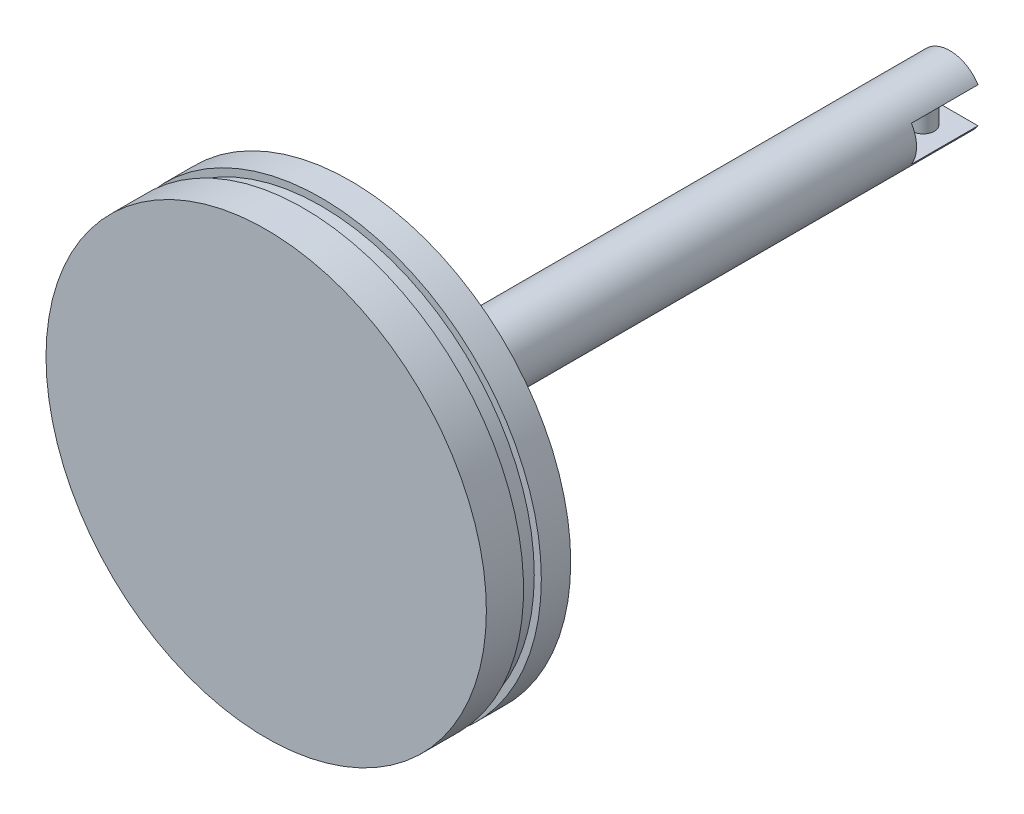
from build123d import *

# Parameters (mm, degrees)
SKETCH1_R           = 49.6
BOSS_EXTRUDE1_DEPTH = 3
SKETCH2_R           = 49.6
SKETCH2_R_2         = 46
BOSS_EXTRUDE2_DEPTH = 15
SKETCH3_R           = 49.6
BOSS_EXTRUDE3_DEPTH = 4
SKETCH4_R           = 2.5
SKETCH4_R_2         = 5
BOSS_EXTRUDE4_DEPTH = 16
SKETCH5_R           = 7.5
BOSS_EXTRUDE5_DEPTH = 135
SKETCH6_W           = 4
SKETCH6_H           = 2.877326051
SKETCH7_W           = 21.216623492
SKETCH7_H           = 8
CUT_EXTRUDE1_DEPTH  = 15
SKETCH8_R           = 2.5
BOSS_EXTRUDE6_DEPTH = 7


with BuildPart() as part:
    # Sketch1 → Boss-Extrude1 (new body)
    with BuildSketch(Plane.XY):
        Circle(SKETCH1_R)
    extrude(amount=BOSS_EXTRUDE1_DEPTH)

    # Sketch2 → Boss-Extrude2 (add)
    with BuildSketch(Plane.XY):
        Circle(SKETCH2_R)
        Circle(SKETCH2_R_2, mode=Mode.SUBTRACT)
    extrude(amount=BOSS_EXTRUDE2_DEPTH)

    # Sketch3 → Boss-Extrude3 (add)
    with BuildSketch(Plane.XY.offset(15)):
        Circle(SKETCH3_R)
    extrude(amount=BOSS_EXTRUDE3_DEPTH)

    # Sketch4 → Boss-Extrude4 (add)
    with BuildSketch(Plane.XY.offset(3)):
        with Locations((-35.987639667, -3.679667055)):
            Circle(SKETCH4_R)
        with Locations((-20.971152057, -26.371770497)):
            Circle(SKETCH4_R)
        with Locations((10.797391405, -30.746904789)):
            Circle(SKETCH4_R)
        with Locations((29.028310122, -5.229746582)):
            Circle(SKETCH4_R)
        with Locations((17.402549466, 21.919229393)):
            Circle(SKETCH4_R)
        with Locations((-12.555375397, 26.332978184)):
            Circle(SKETCH4_R)
        Circle(SKETCH4_R_2)
    extrude(amount=BOSS_EXTRUDE4_DEPTH)

    # Sketch5 → Boss-Extrude5 (add)
    with BuildSketch(Plane.XY):
        Circle(SKETCH5_R)
    extrude(amount=-BOSS_EXTRUDE5_DEPTH)

    # Sketch6 → Cut-Revolve1 (revolve, cut)
    with BuildSketch(Plane(origin=(0, 0, 0), x_dir=(0, 0, -1), z_dir=(1, 0, 0))):
        with Locations((-8.620257655, -49.449045314)):
            Rectangle(SKETCH6_W, SKETCH6_H)
    revolve(axis=Axis((0, 0, 0), (0, 0, 1)), mode=Mode.SUBTRACT)

    # Sketch7 → Cut-Extrude1 (cut)
    with BuildSketch(Plane(origin=(0, 0, -135), x_dir=(-1, 0, 0), z_dir=(0, 0, -1))):
        Rectangle(SKETCH7_W, SKETCH7_H)
    extrude(amount=-CUT_EXTRUDE1_DEPTH, mode=Mode.SUBTRACT)

    # Sketch8 → Boss-Extrude6 (add)
    with BuildSketch(Plane(origin=(0, -4, 0), x_dir=(1, 0, 0), z_dir=(0, 1, 0))):
        with Locations((0, 129)):
            Circle(SKETCH8_R)
    extrude(amount=BOSS_EXTRUDE6_DEPTH)


solid = part.part
